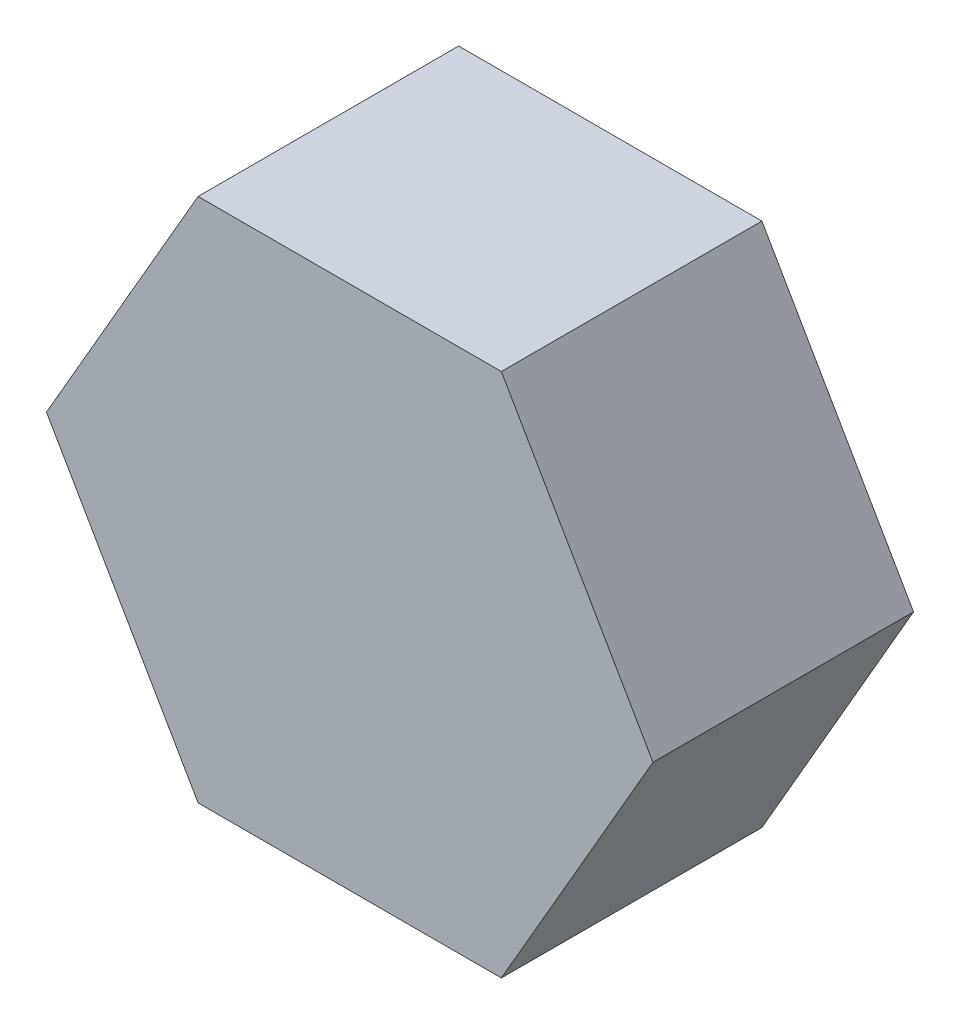
from build123d import *

# Parameters (mm, degrees)
BOSS_EXTRUDE1_DEPTH = 25
SKETCH2_R           = 12.7
CUT_EXTRUDE2_DEPTH  = 20
THREAD1_PITCH       = 2.116666667


with BuildPart() as part:
    # Sketch1 → Boss-Extrude1 (new body)
    with BuildSketch(Plane.XY):
        Polygon((-14.549226784, 25.2), (-29.098453567, 0), (-14.549226784, -25.2), (14.549226784, -25.2), (29.098453567, 0), (14.549226784, 25.2), align=None)
    extrude(amount=BOSS_EXTRUDE1_DEPTH)

    # Sketch2 → Cut-Extrude2 (cut)
    with BuildSketch(Plane.XY):
        Circle(SKETCH2_R)
    extrude(amount=CUT_EXTRUDE2_DEPTH, mode=Mode.SUBTRACT)

    # Thread1: the profile of Thread Profile1 profile screwed along a right-hand helix of 9.448819 turns, 10 arcs to a turn; built about Z, then put on its axis
    thread1_z = Axis((0, 0, 0), (0, 0, 1))
    thread1_corners = [(12.6997, 0, -0.000173205), (13.845679435, 0, 0.66145833), (13.845679435, 0, 0.926041664), (12.6997, 0, 1.587673199)]
    with BuildLine(mode=Mode.PRIVATE) as thread1_profile:
        Line(thread1_corners[0], thread1_corners[1])
        Line(thread1_corners[1], thread1_corners[2])
        Line(thread1_corners[2], thread1_corners[3])
        Line(thread1_corners[3], thread1_corners[0])
    thread1_cap = Face(thread1_profile.wire())
    thread1_turn_angles = [0, 18, 36, 54, 72, 90, 108, 126, 144, 162, 180, 198, 216, 234, 252, 270, 288, 306, 324, 342, 360]
    thread1_turn_weights = [1, 0.9510565162951535, 1, 0.9510565162951535, 1, 0.9510565162951535, 1, 0.9510565162951535, 1, 0.9510565162951535, 1, 0.9510565162951535, 1, 0.9510565162951535, 1, 0.9510565162951535, 1, 0.9510565162951535, 1, 0.9510565162951535, 1]
    thread1_turn_rails = [Edge.make_bspline([Vector(p[0], p[1], 0).rotate(thread1_z, thread1_turn_angles[k]) / thread1_turn_weights[k] + Vector(0, 0, p[2] + THREAD1_PITCH * thread1_turn_angles[k] / 360) for k in range(21)], [0, 0, 0, 1, 1, 2, 2, 3, 3, 4, 4, 5, 5, 6, 6, 7, 7, 8, 8, 9, 9, 10, 10, 10], 2, thread1_turn_weights) for p in thread1_corners]
    thread1_turn_sides = [Face.make_surface_from_curves(thread1_turn_rails[p[0]], thread1_turn_rails[p[1]]) for p in [(0, 1), (1, 2), (2, 3), (3, 0)]]
    thread1_last_angles = [3240, 3258, 3276, 3294, 3312, 3330, 3348, 3366, 3384, 3392.787401575, 3401.57480315]
    thread1_last_weights = [1, 0.9510565162951535, 1, 0.9510565162951535, 1, 0.9510565162951535, 1, 0.9510565162951535, 1, 0.988261996694031, 1]
    thread1_last_rails = [Edge.make_bspline([Vector(p[0], p[1], 0).rotate(thread1_z, thread1_last_angles[k]) / thread1_last_weights[k] + Vector(0, 0, p[2] + THREAD1_PITCH * thread1_last_angles[k] / 360) for k in range(11)], [0, 0, 0, 1, 1, 2, 2, 3, 3, 4, 4, 5, 5, 5], 2, thread1_last_weights) for p in thread1_corners]
    thread1_last_sides = [Face.make_surface_from_curves(thread1_last_rails[p[0]], thread1_last_rails[p[1]]) for p in [(0, 1), (1, 2), (2, 3), (3, 0)]]
    thread1 = Plane(origin=(0, 0, 0), x_dir=(1, 0, 0), z_dir=(0, 0, 1)) * Solid(Shell([*[p.moved(Location((0, 0, THREAD1_PITCH * i))) for i in range(9) for p in thread1_turn_sides], *thread1_last_sides, thread1_cap, thread1_cap.rotate(thread1_z, 3401.57480315).moved(Location((0, 0, THREAD1_PITCH * 3401.57480315 / 360)))]))
    add(thread1, mode=Mode.SUBTRACT)


solid = part.part
